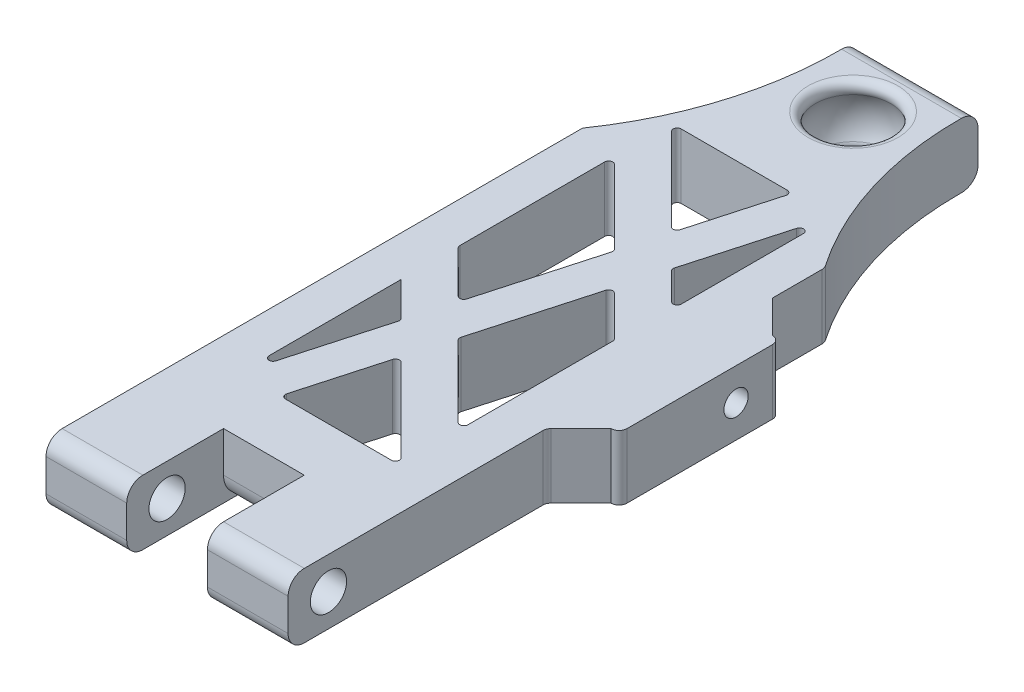
from build123d import *

# Parameters (mm, degrees)
SKETCH1_W               = 30
SKETCH1_H               = 93
BOSS_EXTRUDE1_DEPTH     = 8
SKETCH2_W               = 10
SKETCH2_H               = 12
CUT_EXTRUDE1_DEPTH      = 8
SKETCH3_R               = 2.25
CUT_EXTRUDE2_DEPTH      = 56.91287866
FILLET1_R               = 2
CUT_EXTRUDE3_DEPTH      = 50.51009998
FILLET2_R               = 3
CUT_EXTRUDE4_DEPTH      = 50.51009998
CUT_EXTRUDE4_DEPTH_BACK = 50.51009998
FILLET3_R               = 1
FILLET4_R               = 0.5
SKETCH8_W               = 20
SKETCH8_H               = 8
BOSS_EXTRUDE2_DEPTH     = 5
CUT_EXTRUDE5_DEPTH      = 59.747340518
CUT_EXTRUDE5_DEPTH_BACK = 5
SKETCH9_R               = 1.502727392
CHAMFER1_SIZE           = 4
FILLET5_R               = 1


with BuildPart() as part:
    # Sketch1 → Boss-Extrude1 (new body)
    with BuildSketch(Plane(origin=(0, 0, 0), x_dir=(1, 0, 0), z_dir=(0, 1, 0))):
        Rectangle(SKETCH1_W, SKETCH1_H)
    extrude(amount=BOSS_EXTRUDE1_DEPTH)

    # Sketch2 → Cut-Extrude1 (cut)
    with BuildSketch(Plane(origin=(0, 8, 0), x_dir=(1, 0, 0), z_dir=(0, 1, 0))):
        with Locations((0, -40.5)):
            Rectangle(SKETCH2_W, SKETCH2_H)
    extrude(amount=-CUT_EXTRUDE1_DEPTH, mode=Mode.SUBTRACT)

    # Sketch3 → Cut-Extrude2 (cut, through all)
    with BuildSketch(Plane(origin=(15, 0, 0), x_dir=(0, 0, -1), z_dir=(1, 0, 0))):
        with Locations((-41.5, 4)):
            Circle(SKETCH3_R)
    extrude(amount=-CUT_EXTRUDE2_DEPTH, mode=Mode.SUBTRACT)

    # Fillet1
    fillet1_edges = [part.edges().sort_by_distance(p)[0] for p in [
        (10, 0, 46.5),
        (-10, 8, 46.5),
        (10, 8, 46.5),
        (-10, 0, 46.5),
        (0, 0, -46.5),
        (0, 8, -46.5),
    ]]
    fillet(fillet1_edges, radius=FILLET1_R)

    # Sketch4 → Cut-Extrude3 (cut, through all)
    with BuildSketch(Plane(origin=(0, 8, 0), x_dir=(1, 0, 0), z_dir=(0, 1, 0))):
        Polygon((5, 26), (-10, 26), (1.715328467, 14.284671533), align=None)
        Polygon((10, 6), (10, 26), (5.620437956, 10.379562044), align=None)
        Polygon((-10, -7.5), (-10, -27.5), (-5.620437956, -11.879562044), align=None)
        Polygon((-5, -27.5), (10, -27.5), (-1.715328467, -15.784671533), align=None)
        Polygon((-10, 18.928932188), (-10, -0.428932188), (-4.072028946, -6.356903242), (0.166919457, 8.762012731), align=None)
        Polygon((9.732575479, -20.161507667), (9.732575479, -0.803643291), (4.072028946, 4.856903242), (-0.166919457, -10.262012731), align=None)
    extrude(amount=-CUT_EXTRUDE3_DEPTH, mode=Mode.SUBTRACT)

    # Fillet2
    fillet2_edges = [part.edges().sort_by_distance(p)[0] for p in [
        (0, 0, 34.5),
    ]]
    fillet(fillet2_edges, radius=FILLET2_R)

    # Sketch6 → Cut-Extrude4 (cut, two sides: drawn at the far end of the back side and taken through both)
    with BuildSketch(Plane(origin=(0, 8, 0), x_dir=(1, 0, 0), z_dir=(0, 1, 0)).offset(-CUT_EXTRUDE4_DEPTH_BACK)):
        with BuildLine():
            Line((-7.477541934, 46.5), (-15, 46.5))
            Line((-15, 46.5), (-15, 19.983197599))
            ThreePointArc((-15, 19.983197599), (-9.022671438, 32.612921347), (-7.477541934, 46.5))
        make_face()
        with BuildLine():
            Line((15, 46.5), (15, 19.983197599))
            ThreePointArc((15, 19.983197599), (9.022671438, 32.612921347), (7.477541934, 46.5))
            Line((7.477541934, 46.5), (15, 46.5))
        make_face()
    extrude(amount=CUT_EXTRUDE4_DEPTH + CUT_EXTRUDE4_DEPTH_BACK, mode=Mode.SUBTRACT)

    # Sketch5 → Cut-Revolve1 (revolve, cut)
    with BuildSketch(Plane(origin=(0, 0, 0), x_dir=(0, 0, -1), z_dir=(1, 0, 0))):
        with BuildLine():
            Line((38.5, 8), (38.5, 0))
            Line((38.5, 0), (42, 0))
            ThreePointArc((42, 0), (43.815072906, 4), (42, 8))
            Line((42, 8), (38.5, 8))
        make_face()
    revolve(axis=Axis((0, 8, -38.5), (0, -1, 0)), mode=Mode.SUBTRACT)

    # Fillet3
    fillet3_edges = [part.edges().sort_by_distance(p)[0] for p in [
        (0, 8, -35),
        (0, 0, -35),
    ]]
    fillet(fillet3_edges, radius=FILLET3_R)

    # Fillet4
    fillet4_edges = [part.edges().sort_by_distance(p)[0] for p in [
        (-10, 4, -18.928932188),
        (0.166919457, 4, -8.762012731),
        (-4.072028946, 4, 6.356903242),
        (-10, 4, 0.428932188),
        (-1.715328467, 4, 15.784671533),
        (10, 4, 27.5),
        (-5, 4, 27.5),
        (10, 4, -6),
        (5.620437956, 4, -10.379562044),
        (10, 4, -26),
        (-5.620437956, 4, 11.879562044),
        (-10, 4, 27.5),
        (9.732575479, 4, 20.161507667),
        (-0.166919457, 4, 10.262012731),
        (4.072028946, 4, -4.856903242),
        (9.732575479, 4, 0.803643291),
        (5, 4, -26),
        (1.715328467, 4, -14.284671533),
        (-10, 4, -26),
    ]]
    fillet(fillet4_edges, radius=FILLET4_R)

    # Sketch8 → Boss-Extrude2 (add)
    with BuildSketch(Plane(origin=(15, 0, 0), x_dir=(0, 0, -1), z_dir=(1, 0, 0))):
        with Locations((-0.5, 4)):
            Rectangle(SKETCH8_W, SKETCH8_H)
    extrude(amount=BOSS_EXTRUDE2_DEPTH)

    # Sketch9 → Cut-Extrude5 (cut, two sides: drawn at the far end of the back side and taken through both)
    with BuildSketch(Plane(origin=(20, 0, 0), x_dir=(0, 0, -1), z_dir=(1, 0, 0)).offset(-CUT_EXTRUDE5_DEPTH_BACK)):
        with Locations((4, 4)):
            Circle(SKETCH9_R)
    extrude(amount=CUT_EXTRUDE5_DEPTH + CUT_EXTRUDE5_DEPTH_BACK, mode=Mode.SUBTRACT)

    # Chamfer1
    chamfer1_edges = [part.edges().sort_by_distance(p)[0] for p in [
        (15, 4, 10.5),
        (15, 4, -9.5),
    ]]
    chamfer(chamfer1_edges, length=CHAMFER1_SIZE)

    # Fillet5
    fillet5_edges = [part.edges().sort_by_distance(p)[0] for p in [
        (20, 4, 10.5),
        (15, 4, 14.5),
        (15, 4, -19.983197599),
        (20, 4, -9.5),
    ]]
    fillet(fillet5_edges, radius=FILLET5_R - 0.0001)  # a hair under: the kernel refuses the full size


solid = part.part
